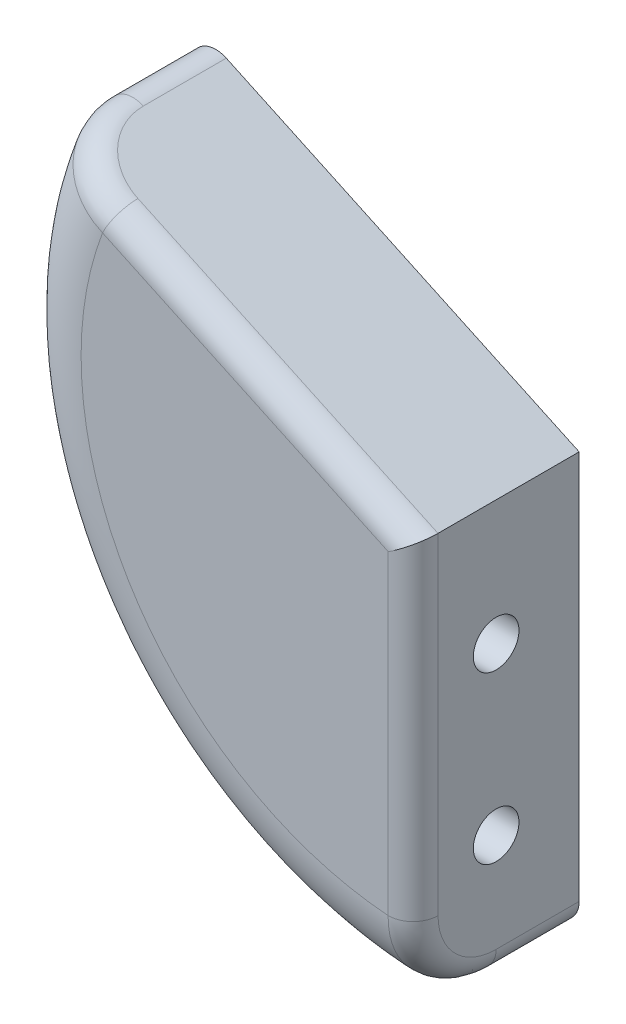
from build123d import *

# Parameters (mm, degrees)
BOSS_EXTRUDE1_DEPTH     = 20
CUT_EXTRUDE1_REACH      = 75.485
CUT_EXTRUDE1_END_RADIUS = 50
SKETCH3_R               = 2.75
CUT_EXTRUDE2_REACH      = 70.602
CUT_EXTRUDE2_END_RADIUS = 50
SKETCH4_R               = 4.5
FILLET1_R               = 10
FILLET2_R               = 3


with BuildPart() as part:
    # Sketch2 → Boss-Extrude1 (new body)
    with BuildSketch(Plane.XY):
        with BuildLine():
            Line((0, 0), (-45.315389352, 21.130913087))
            ThreePointArc((-45.315389352, 21.130913087), (-42.169572291, -26.864980417), (0, -50))
            Line((0, -50), (0, 0))
        make_face()
    extrude(amount=BOSS_EXTRUDE1_DEPTH)

    # Cut-Extrude1: up to this cylinder (the profile starts inside it)
    cut_extrude1_end = Plane(origin=(0, 0, 10), z_dir=(0, 0, -1)) * Cylinder(CUT_EXTRUDE1_END_RADIUS, 251.97, mode=Mode.PRIVATE)
    # Sketch3 → Cut-Extrude1 (cut, up to the surface)
    with BuildSketch(Plane(origin=(0, 0, 0), x_dir=(0, 0, -1), z_dir=(1, 0, 0)), mode=Mode.PRIVATE) as cut_extrude1_sk1:
        with Locations(Location((-10, -35, 0), (0, 0, 90))):
            Circle(SKETCH3_R)
    cut_extrude1_tool1 = extrude(cut_extrude1_sk1.sketch, amount=-CUT_EXTRUDE1_REACH, mode=Mode.PRIVATE) & cut_extrude1_end
    add(cut_extrude1_tool1.solids().sort_by_distance((0, -35, 10))[0], mode=Mode.SUBTRACT)
    # Sketch3 → Cut-Extrude1 (cut, up to the surface)
    with BuildSketch(Plane(origin=(0, 0, 0), x_dir=(0, 0, -1), z_dir=(1, 0, 0)), mode=Mode.PRIVATE) as cut_extrude1_sk2:
        with Locations(Location((-10, -15, 0), (0, 0, 90))):
            Circle(SKETCH3_R)
    cut_extrude1_tool2 = extrude(cut_extrude1_sk2.sketch, amount=-CUT_EXTRUDE1_REACH, mode=Mode.PRIVATE) & cut_extrude1_end
    add(cut_extrude1_tool2.solids().sort_by_distance((0, -15, 10))[0], mode=Mode.SUBTRACT)

    # Cut-Extrude2: up to this cylinder (the profile starts inside it)
    cut_extrude2_end = Plane(origin=(0, 0, 10), z_dir=(0, 0, -1)) * Cylinder(CUT_EXTRUDE2_END_RADIUS, 242.204, mode=Mode.PRIVATE)
    # Sketch4 → Cut-Extrude2 (cut, up to the surface)
    with BuildSketch(Plane(origin=(-7.5, 0, 0), x_dir=(0, 0, -1), z_dir=(1, 0, 0)), mode=Mode.PRIVATE) as cut_extrude2_sk1:
        with Locations(Location((-10, -15, 0), (0, 0, 90))):
            Circle(SKETCH4_R)
    cut_extrude2_tool1 = extrude(cut_extrude2_sk1.sketch, amount=-CUT_EXTRUDE2_REACH, mode=Mode.PRIVATE) & cut_extrude2_end
    add(cut_extrude2_tool1.solids().sort_by_distance((-7.5, -15, 10))[0], mode=Mode.SUBTRACT)
    # Sketch4 → Cut-Extrude2 (cut, up to the surface)
    with BuildSketch(Plane(origin=(-7.5, 0, 0), x_dir=(0, 0, -1), z_dir=(1, 0, 0)), mode=Mode.PRIVATE) as cut_extrude2_sk2:
        with Locations(Location((-10, -35, 0), (0, 0, 90))):
            Circle(SKETCH4_R)
    cut_extrude2_tool2 = extrude(cut_extrude2_sk2.sketch, amount=-CUT_EXTRUDE2_REACH, mode=Mode.PRIVATE) & cut_extrude2_end
    add(cut_extrude2_tool2.solids().sort_by_distance((-7.5, -35, 10))[0], mode=Mode.SUBTRACT)

    # Fillet1
    # the kernel refuses this fillet: 10 mm, written as the material it takes off along each edge
    with BuildSketch(Plane(origin=(0, 0, 20), x_dir=(-0.5924817254083071, 0.8055838907632124, 0), z_dir=(0.8055838907632124, 0.5924817254083071, 0))) as fillet1_piece_1:
        with BuildLine():
            CenterArc((50 - FILLET1_R, -FILLET1_R), FILLET1_R, 0, 90)
            Line((50 - FILLET1_R, 0), (50, 0))
            Line((50, 0), (50, -FILLET1_R))
        make_face()
    revolve(axis=Axis((0, 0, 20), (0, 0, 1)), revolution_arc=172.333365089, mode=Mode.SUBTRACT)

    # Fillet2
    fillet2_edges = [part.edges().sort_by_distance(p)[0] for p in [
        (0, -20, 20),
        (0, -50, 5),
        (0, -47.071067812, 17.071067812),
        (-45.315389352, 21.130913087, 5),
        (-42.660875302, 19.893092857, 17.071067812),
        (-18.126155741, 8.452365235, 20),
    ]]
    fillet(fillet2_edges, radius=FILLET2_R)


solid = part.part
